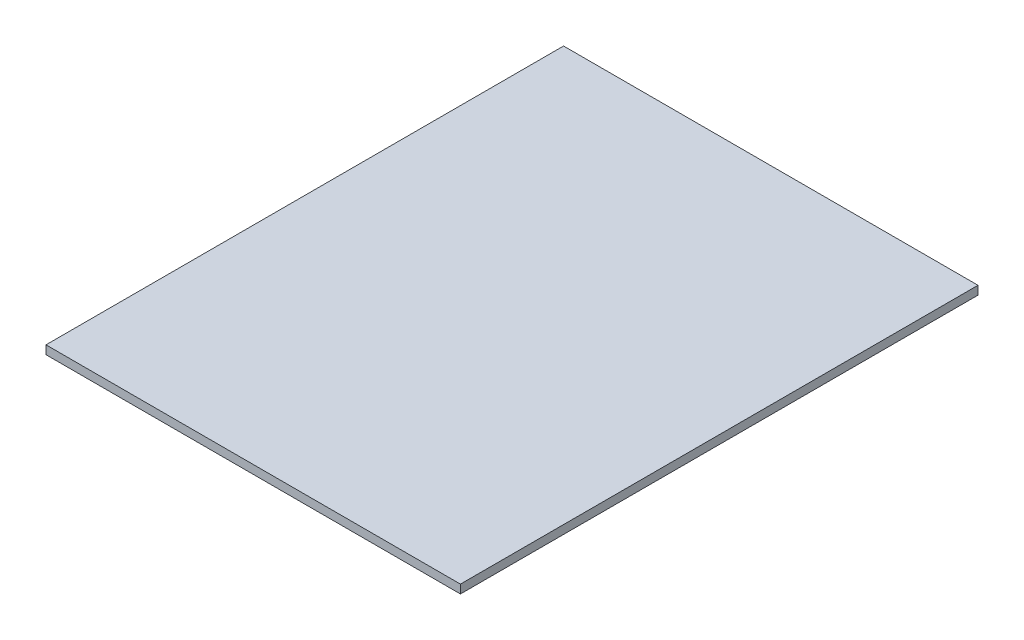
from build123d import *

# Parameters (mm, degrees)
SKETCH1_W           = 144.93
SKETCH1_H           = 181
BOSS_EXTRUDE1_DEPTH = 3


with BuildPart() as part:
    # Sketch1 → Boss-Extrude1 (new body)
    with BuildSketch(Plane(origin=(0, 0, 0), x_dir=(1, 0, 0), z_dir=(0, 1, 0))):
        with Locations((72.465, 90.5)):
            Rectangle(SKETCH1_W, SKETCH1_H)
    extrude(amount=BOSS_EXTRUDE1_DEPTH)


solid = part.part
